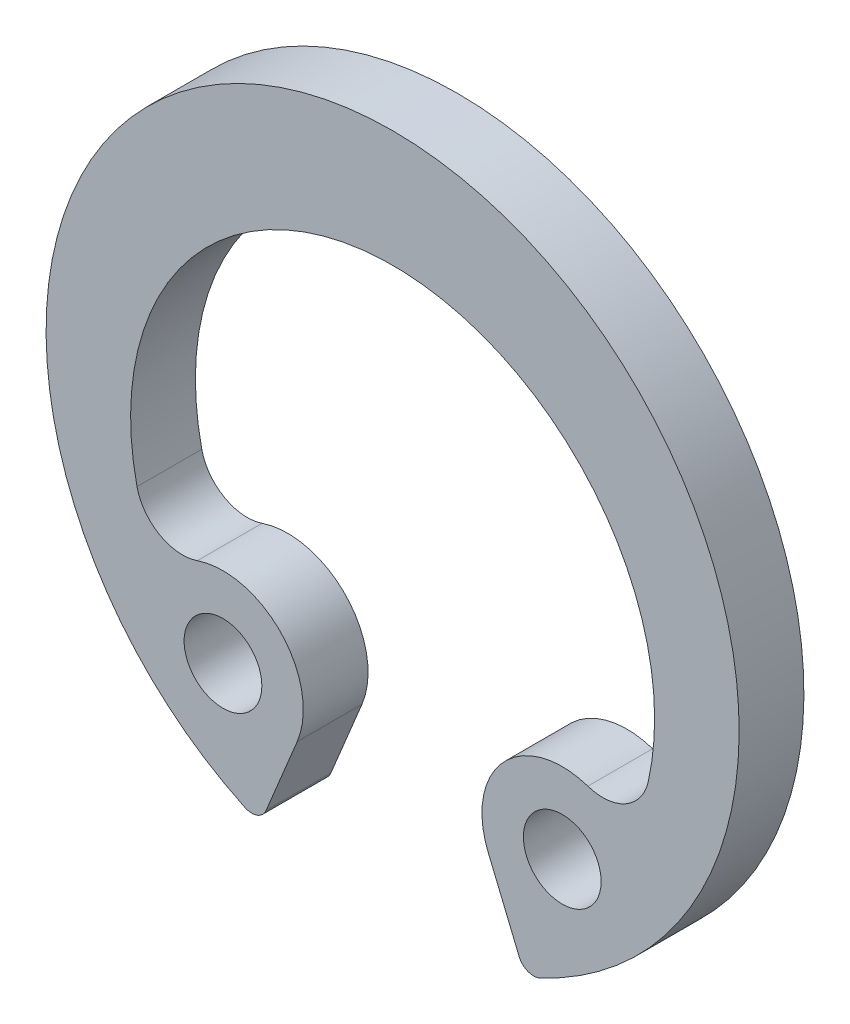
from build123d import *

# Parameters (mm, degrees)
BODYSKE_R      = 0.6
BASEBODY_DEPTH = 1
FILLET1_R      = 0.72
FILLET2_R      = 0.24


with BuildPart() as part:
    # BodySke → BaseBody (new body)
    with BuildSketch(Plane.XY):
        with BuildLine():
            ThreePointArc((3.09348341, -1.937139633), (1.742218648, -2.205922905), (1.473435376, -3.557187667))
            Line((1.473435376, -3.557187667), (2.047356363, -4.942755499))
            ThreePointArc((2.047356363, -4.942755499), (0, 5.35), (-2.047356363, -4.942755499))
            Line((-2.047356363, -4.942755499), (-1.473435376, -3.557187667))
            ThreePointArc((-1.473435376, -3.557187667), (-1.742218648, -2.205922905), (-3.09348341, -1.937139633))
            Line((-3.09348341, -1.937139633), (-3.677728984, -2.179142073))
            ThreePointArc((-3.677728984, -2.179142073), (0, 3.55), (3.677728984, -2.179142073))
            Line((3.677728984, -2.179142073), (3.09348341, -1.937139633))
        make_face()
        with Locations((-2.618982327, -3.082686584)):
            Circle(BODYSKE_R, mode=Mode.SUBTRACT)
        with Locations((2.618982327, -3.082686584)):
            Circle(BODYSKE_R, mode=Mode.SUBTRACT)
    extrude(amount=BASEBODY_DEPTH)

    # Fillet1
    fillet1_edges = [part.edges().sort_by_distance(p)[0] for p in [
        (3.677728984, -2.179142073, 0.5),
        (-3.677728984, -2.179142073, 0.5),
    ]]
    fillet(fillet1_edges, radius=FILLET1_R)

    # Fillet2
    fillet2_edges = [part.edges().sort_by_distance(p)[0] for p in [
        (2.047356363, -4.942755499, 0.5),
        (-2.047356363, -4.942755499, 0.5),
    ]]
    fillet(fillet2_edges, radius=FILLET2_R)


solid = part.part
